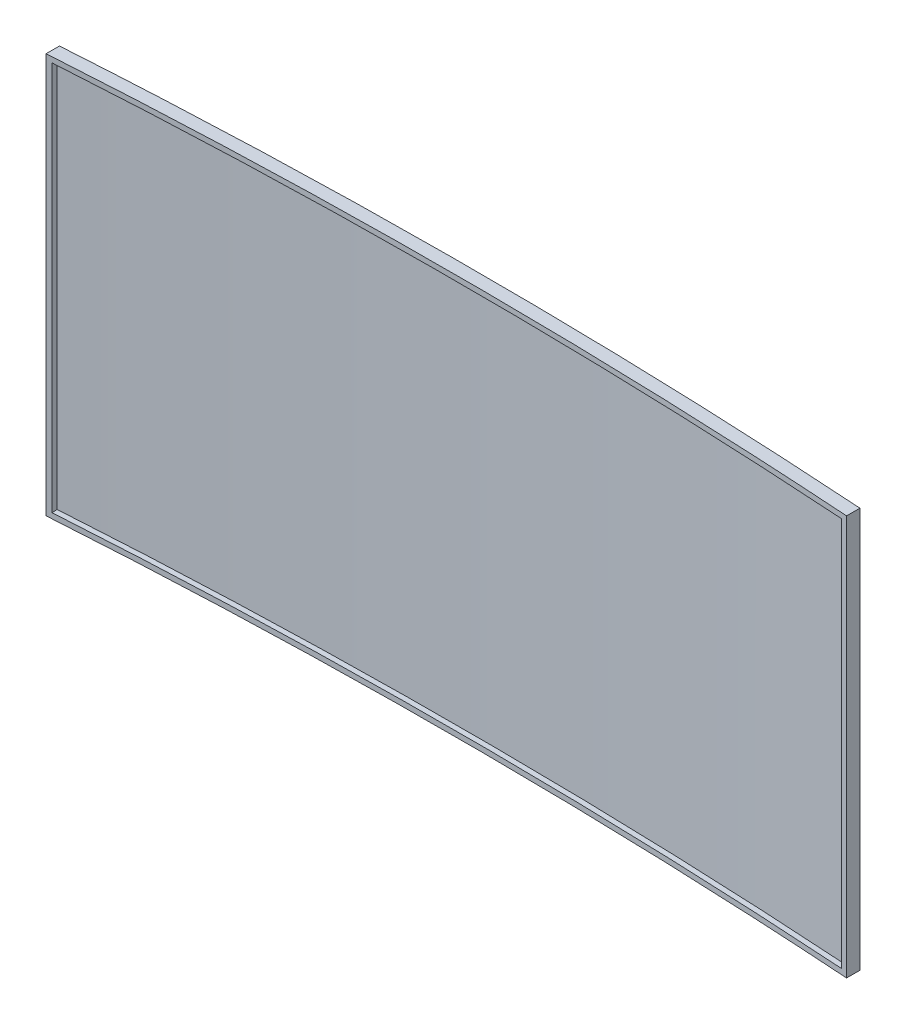
from build123d import *

# Parameters (mm, degrees)
BOSS_EXTRUDE1_DEPTH = 150
WRAP1_START         = 2
WRAP1_DEPTH         = 146
SKETCH5_W           = 52
SKETCH5_H           = 7.004650575
BOSS_EXTRUDE2_DEPTH = 100
SKETCH6_W           = 52
SKETCH6_H           = 6.943317242
CUT_EXTRUDE1_DEPTH  = 48
SKETCH7_R           = 25
CUT_EXTRUDE7_DEPTH  = 2
FILLET1_R           = 10


# Read off the part's stored shape, not the designer's step: Wrap1
with BuildPart() as part:
    # Sketch1 → Boss-Extrude1 (new body)
    with BuildSketch(Plane(origin=(0, 0, 0), x_dir=(1, 0, 0), z_dir=(0, 1, 0))):
        with BuildLine():
            Line((150, 13.582690372), (150, 18.582690372))
            add(Edge.make_bspline(
                [(150, 18.582690372), (0, 28.582690372), (-150, 18.582690372)],
                knots=[0, 0, 0, 1, 1, 1], degree=2))
            Line((-150, 18.582690372), (-150, 13.582690372))
            add(Edge.make_bspline(
                [(150, 13.582690372), (0, 23.582690372), (-150, 13.582690372)],
                knots=[0, 0, 0, 1, 1, 1], degree=2))
        make_face()
    extrude(amount=BOSS_EXTRUDE1_DEPTH)

    # Wrap1 outline → Wrap1 (cut)
    with BuildSketch(Plane(origin=(0, 0, 0), x_dir=(1, 0, 0), z_dir=(0, 1, 0)).offset(WRAP1_START)):
        with BuildLine():
            add(Edge.make_bspline(
                [(-148.024677757, 15.717831092), (-74.012620983, 20.582676475), (1e-09, 22.204328649), (74.012620985, 20.582676475), (148.024677759, 15.717831092)],
                knots=[0.007021667, 0.007021667, 0.007021667, 0.007021667, 0.007021667, 0.992978333, 0.992978333, 0.992978333, 0.992978333, 0.992978333], degree=4))
            Line((-148.024677757, 15.717831092), (-147.89349994, 13.722137634))
            add(Edge.make_bspline(
                [(-147.89349994, 13.722137634), (0, 23.443243111), (147.89349994, 13.722137634)],
                knots=[0.007021667, 0.007021667, 0.007021667, 0.992978333, 0.992978333, 0.992978333], degree=2))
            Line((147.89349994, 13.722137634), (148.024677759, 15.717831092))
        make_face()
    extrude(amount=WRAP1_DEPTH, mode=Mode.SUBTRACT)

    # Sketch5 → Boss-Extrude2 (add)
    with BuildSketch(Plane(origin=(0, 0, 0), x_dir=(1, 0, 0), z_dir=(0, 1, 0))):
        with Locations((0, 26.934793438)):
            Rectangle(SKETCH5_W, SKETCH5_H)
    extrude(amount=BOSS_EXTRUDE2_DEPTH)

    # Sketch6 → Cut-Extrude1 (cut)
    with BuildSketch(Plane.XZ):
        with Locations((0, -26.965460104)):
            Rectangle(SKETCH6_W, SKETCH6_H)
    extrude(amount=-CUT_EXTRUDE1_DEPTH, mode=Mode.SUBTRACT)

    # Sketch7 → Cut-Extrude7 (cut)
    with BuildSketch(Plane(origin=(0, 0, -30.437118725), x_dir=(-1, 0, 0), z_dir=(0, 0, -1))):
        with Locations((0, 74)):
            Circle(SKETCH7_R)
    extrude(amount=-CUT_EXTRUDE7_DEPTH, mode=Mode.SUBTRACT)

    # Fillet1
    fillet1_edges = [part.edges().sort_by_distance(p)[0] for p in [
        (-26, 100, -26.934793437),
        (-26, 48, -26.965460104),
        (26, 48, -26.965460104),
        (26, 100, -26.934793437),
    ]]
    fillet(fillet1_edges, radius=FILLET1_R)


solid = part.part
